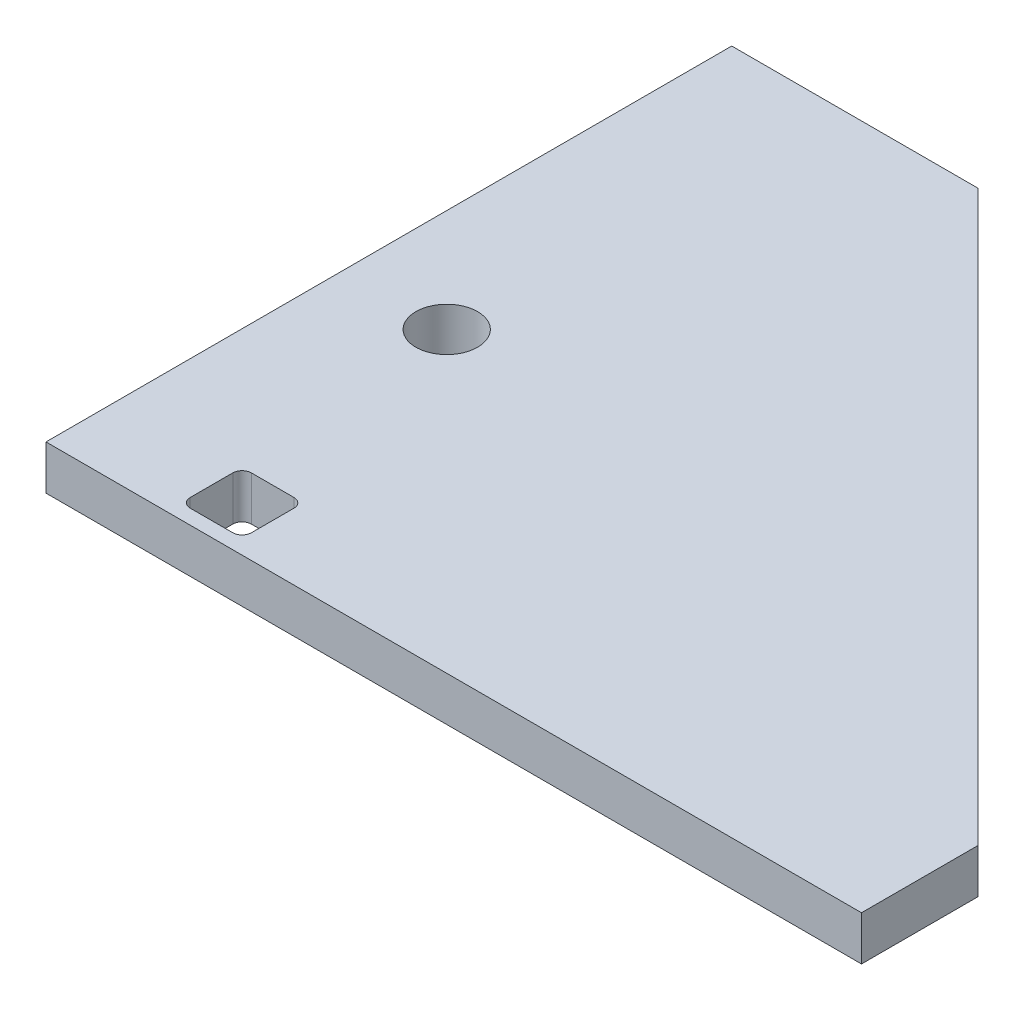
from build123d import *

# Parameters (mm, degrees)
BOSS_EXTRUDE1_DEPTH = 38.1
SKETCH2_R           = 26.5
CUT_EXTRUDE1_DEPTH  = 459.875847071
CUT_EXTRUDE2_DEPTH  = 459.875847071


with BuildPart() as part:
    # Sketch1 → Boss-Extrude1 (new body)
    with BuildSketch(Plane(origin=(0, 0, 0), x_dir=(1, 0, 0), z_dir=(0, 1, 0))):
        Polygon((-138.61, 294.305), (350, -194.305), (350, -294.305), (-350, -294.305), (-350, 294.305), align=None)
    extrude(amount=BOSS_EXTRUDE1_DEPTH)

    # Sketch2 → Cut-Extrude1 (cut, through all)
    with BuildSketch(Plane(origin=(0, 0, 0), x_dir=(-1, 0, 0), z_dir=(0, -1, 0))):
        with Locations((261.63290744, -38.711846895)):
            Circle(SKETCH2_R)
    extrude(amount=-CUT_EXTRUDE1_DEPTH, mode=Mode.SUBTRACT)

    # Sketch3 → Cut-Extrude2 (cut, through all)
    with BuildSketch(Plane.XZ):
        with BuildLine():
            Line((-194.317185165, 237.169182938), (-194.317185165, 273.669182938))
            ThreePointArc((-194.317185165, 273.669182938), (-196.660330915, 279.326037187), (-202.317185165, 281.669182938))
            Line((-202.317185165, 281.669182938), (-238.817185165, 281.669182938))
            ThreePointArc((-238.817185165, 281.669182938), (-244.474039414, 279.326037187), (-246.817185165, 273.669182938))
            Line((-246.817185165, 273.669182938), (-246.817185165, 237.169182938))
            ThreePointArc((-246.817185165, 237.169182938), (-244.474039414, 231.512328688), (-238.817185165, 229.169182938))
            Line((-238.817185165, 229.169182938), (-202.317185165, 229.169182938))
            ThreePointArc((-202.317185165, 229.169182938), (-196.660330915, 231.512328688), (-194.317185165, 237.169182938))
        make_face()
    extrude(amount=-CUT_EXTRUDE2_DEPTH, mode=Mode.SUBTRACT)


solid = part.part
